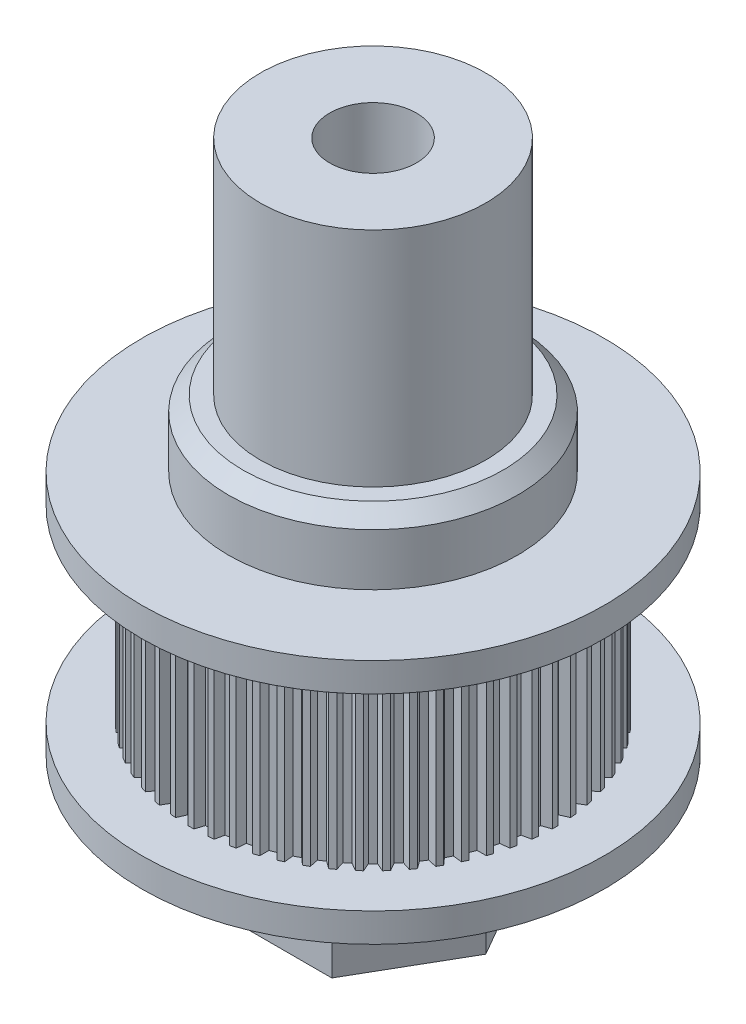
from build123d import *

# Parameters (mm, degrees)
BOSS_EXTRUDE1_DEPTH = 4
SKETCH2_R           = 8
SKETCH2_R_2         = 5
BOSS_EXTRUDE2_DEPTH = 1
SKETCH4_R           = 6
BOSS_EXTRUDE3_DEPTH = 6.5
BOSS_EXTRUDE4_DEPTH = 6.5
CIRPATTERN1_COUNT   = 60
SKETCH6_R           = 8
BOSS_EXTRUDE5_DEPTH = 1
SKETCH7_R           = 3.9
BOSS_EXTRUDE6_DEPTH = 10
SKETCH8_R           = 1.5
CUT_EXTRUDE1_DEPTH  = 26.184320519
SKETCH9_R           = 5
SKETCH9_R_2         = 1.5
BOSS_EXTRUDE7_DEPTH = 2.3
CHAMFER1_SIZE       = 0.5


with BuildPart() as part:
    # Sketch1 → Boss-Extrude1 (new body)
    with BuildSketch(Plane(origin=(0, 0, 0), x_dir=(1, 0, 0), z_dir=(0, 1, 0))):
        Polygon((1.95, 3.377499075), (-1.95, 3.377499075), (-3.9, 0), (-1.95, -3.377499075), (1.95, -3.377499075), (3.9, 0), align=None)
    extrude(amount=BOSS_EXTRUDE1_DEPTH)


with BuildPart() as body_2:
    # Sketch2 → Boss-Extrude2 (new body)
    # profile 1 of 3: a face of its own
    with BuildSketch(Plane(origin=(0, 4, 0), x_dir=(1, 0, 0), z_dir=(0, 1, 0))):
        with Locations(Location((0, 0, 0), (0, 0, 270))):
            Circle(SKETCH2_R)
        Circle(SKETCH2_R_2, mode=Mode.SUBTRACT)
    # profile 2 of 3: a face of its own
    with BuildSketch(Plane(origin=(0, 4, 0), x_dir=(1, 0, 0), z_dir=(0, 1, 0))):
        Circle(SKETCH2_R_2)
        Polygon((3.9, 0), (1.95, 3.377499075), (-1.95, 3.377499075), (-3.9, 0), (-1.95, -3.377499075), (1.95, -3.377499075), align=None, mode=Mode.SUBTRACT)
    # profile 3 of 3: a face of its own
    with BuildSketch(Plane(origin=(0, 4, 0), x_dir=(1, 0, 0), z_dir=(0, 1, 0))):
        Polygon((1.95, -3.377499075), (3.9, 0), (1.95, 3.377499075), (-1.95, 3.377499075), (-3.9, 0), (-1.95, -3.377499075), align=None)
    extrude(amount=BOSS_EXTRUDE2_DEPTH)

    # Sketch4 → Boss-Extrude3 (add)
    with BuildSketch(Plane(origin=(0, 5, 0), x_dir=(1, 0, 0), z_dir=(0, 1, 0))):
        with Locations(Location((0, 0, 0), (0, 0, 90))):
            Circle(SKETCH4_R)
    extrude(amount=BOSS_EXTRUDE3_DEPTH)

    # Sketch5 → Boss-Extrude4 (add)
    with BuildSketch(Plane(origin=(0, 11.5, 0), x_dir=(1, 0, 0), z_dir=(0, 1, 0))):
        with BuildLine():
            Line((-0.2, 5.99666574), (-0.1, 6.3))
            Line((-0.1, 6.3), (0.1, 6.3))
            Line((0.1, 6.3), (0.2, 5.99666574))
            ThreePointArc((0.2, 5.99666574), (0, 6), (-0.2, 5.99666574))
        make_face()
    boss_extrude4 = extrude(amount=-BOSS_EXTRUDE4_DEPTH)

    # CirPattern1: Boss-Extrude4 ×60 about axis
    cirpattern1_axis = Axis((0, 0, 0), (0, 1, 0))
    for i in range(1, CIRPATTERN1_COUNT):
        add(boss_extrude4.rotate(cirpattern1_axis, i * 360 / CIRPATTERN1_COUNT))

    # Sketch6 → Boss-Extrude5 (add)
    with BuildSketch(Plane(origin=(0, 11.5, 0), x_dir=(1, 0, 0), z_dir=(0, 1, 0))):
        with Locations(Location((0, 0, 0), (0, 0, 270))):
            Circle(SKETCH6_R)
    extrude(amount=BOSS_EXTRUDE5_DEPTH)

    # Sketch7 → Boss-Extrude6 (add)
    with BuildSketch(Plane(origin=(0, 12.5, 0), x_dir=(1, 0, 0), z_dir=(0, 1, 0))):
        with Locations(Location((0, 0, 0), (0, 0, 270))):
            Circle(SKETCH7_R)
    extrude(amount=BOSS_EXTRUDE6_DEPTH)


with BuildPart() as cut_extrude1_tool:
    # Sketch8 → Cut-Extrude1 (new, through all)
    with BuildSketch(Plane.XZ):
        with Locations(Location((0, 0, 0), (0, 0, 270))):
            Circle(SKETCH8_R)
    extrude(amount=-CUT_EXTRUDE1_DEPTH)


with BuildPart() as part_1:
    add(part.part)

    # Cut-Extrude1: cut by cut_extrude1_tool
    add(cut_extrude1_tool.part, mode=Mode.SUBTRACT)


with BuildPart() as body_2_1:
    add(body_2.part)

    # Cut-Extrude1: cut by cut_extrude1_tool
    add(cut_extrude1_tool.part, mode=Mode.SUBTRACT)

    # Sketch9 → Boss-Extrude7 (add)
    with BuildSketch(Plane(origin=(0, 12.5, 0), x_dir=(1, 0, 0), z_dir=(0, 1, 0))):
        with Locations(Location((0, 0, 0), (0, 0, 270))):
            Circle(SKETCH9_R)
        with Locations(Location((0, 0, 0), (0, 0, 90))):
            Circle(SKETCH9_R_2, mode=Mode.SUBTRACT)
    extrude(amount=BOSS_EXTRUDE7_DEPTH)

    # Chamfer1
    chamfer1_edges = [body_2_1.edges().sort_by_distance(p)[0] for p in [
        (0, 14.8, -5),
    ]]
    chamfer(chamfer1_edges, length=CHAMFER1_SIZE)


solid = Compound([part_1.part, body_2_1.part])
